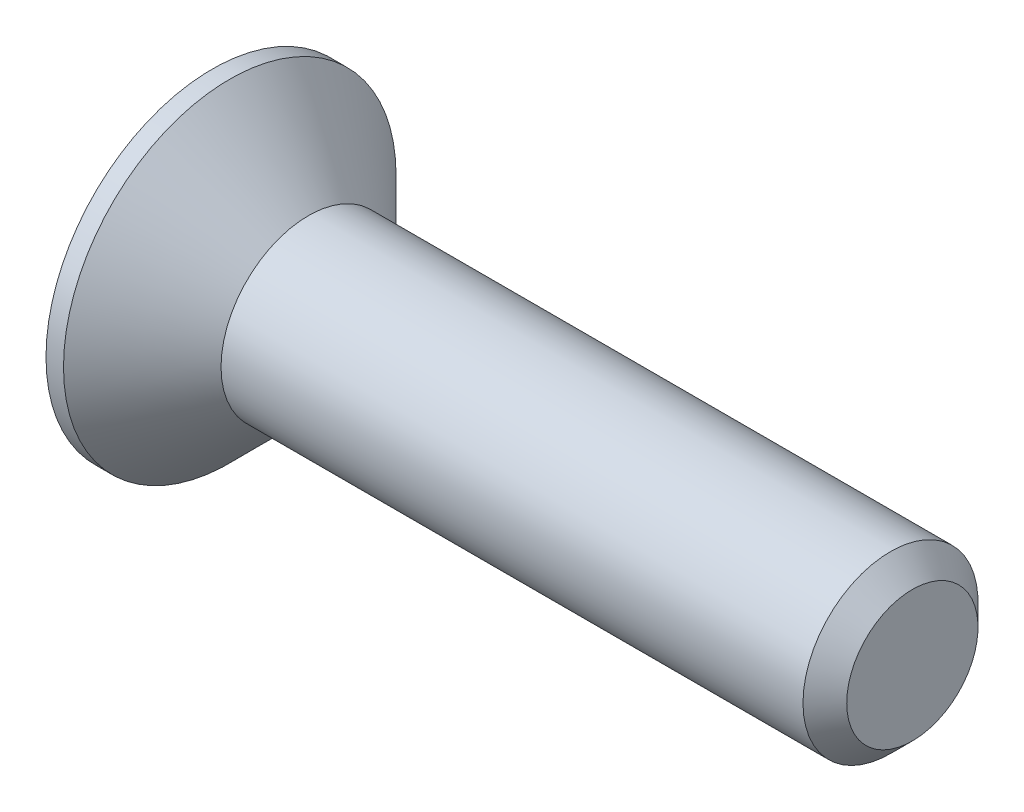
from build123d import *

# Parameters (mm, degrees)
CUT_EXTRUDE1_DEPTH = 0.8


with BuildPart() as part:
    # Sketch2 → Revolve1 (revolve)
    with BuildSketch(Plane.XY):
        Polygon((0, 0), (0, 1.9), (0.2, 1.9), (1.1, 1), (7.75, 1), (8, 0.75), (8, 0), align=None)
    revolve(axis=Axis((-2.281841559, 0, 0), (1, 0, 0)))

    # Sketch3 → Cut-Extrude1 (cut)
    with BuildSketch(Plane.ZY):
        Polygon((0.433012702, -0.75), (0.866025404, 0), (0.433012702, 0.75), (-0.433012702, 0.75), (-0.866025404, 0), (-0.433012702, -0.75), align=None)
    extrude(amount=-CUT_EXTRUDE1_DEPTH, mode=Mode.SUBTRACT)


solid = part.part
